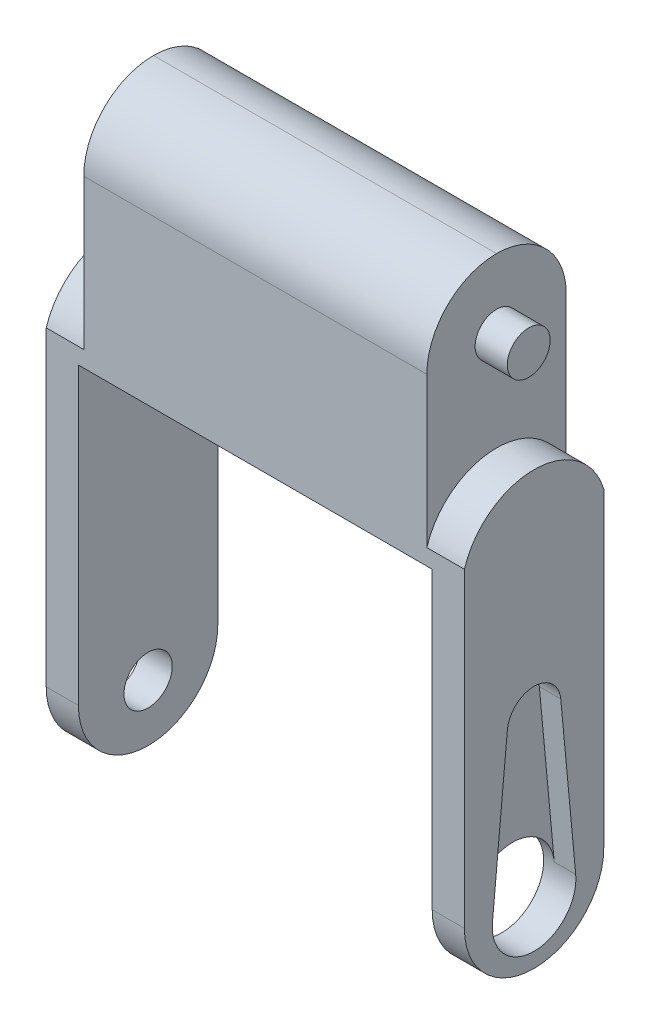
from build123d import *

# Parameters (mm, degrees)
BOSS_EXTRUDE1_DEPTH = 13
SKETCH2_R           = 2.25
CUT_EXTRUDE1_DEPTH  = 3
SKETCH3_R           = 2
BOSS_EXTRUDE2_DEPTH = 3
BOSS_EXTRUDE3_START = 3
SKETCH4_R           = 2
BOSS_EXTRUDE3_DEPTH = 3
CUT_EXTRUDE2_DEPTH  = 3.5
CUT_EXTRUDE3_START  = -3.5
CUT_EXTRUDE3_DEPTH  = 3.5
FILLET1_R           = 6.5
FILLET2_R           = 6.5
SKETCH7_R           = 3.9
CUT_EXTRUDE4_DEPTH  = 68.830671528
CUT_EXTRUDE5_START  = -2
CUT_EXTRUDE5_DEPTH  = 2


with BuildPart() as part:
    # Sketch1 → Boss-Extrude1 (new body)
    with BuildSketch(Plane.XY):
        Polygon((3, 0), (3, 34), (36, 34), (36, 0), (39, 0), (39, 42), (35.5, 42), (35.5, 56), (3.5, 56), (3.5, 42), (0, 42), (0, 0), align=None)
    extrude(amount=BOSS_EXTRUDE1_DEPTH)

    # Sketch2 → Cut-Extrude1 (cut)
    with BuildSketch(Plane.ZY):
        with Locations((6.5, 5.293988539)):
            Circle(SKETCH2_R)
    extrude(amount=-CUT_EXTRUDE1_DEPTH, mode=Mode.SUBTRACT)

    # Sketch3 → Boss-Extrude2 (add)
    with BuildSketch(Plane.ZY.offset(-3.5)):
        with Locations(Location((6.5, 49.5, 0), (0, 0, 180))):
            Circle(SKETCH3_R)
    extrude(amount=BOSS_EXTRUDE2_DEPTH)

    # Sketch4 → Boss-Extrude3 (add)
    with BuildSketch(Plane(origin=(35.5, 0, 0), x_dir=(0, 0, -1), z_dir=(1, 0, 0)).offset(BOSS_EXTRUDE3_START)):
        with Locations((-6.5, 49.5)):
            Circle(SKETCH4_R)
    extrude(amount=-BOSS_EXTRUDE3_DEPTH)

    # Sketch5 → Cut-Extrude2 (cut)
    with BuildSketch(Plane(origin=(39, 0, 0), x_dir=(0, 0, -1), z_dir=(1, 0, 0))):
        with BuildLine():
            Line((0, 35.5), (0, 45))
            Line((0, 45), (-13, 45))
            Line((-13, 45), (-13, 35.5))
            ThreePointArc((-13, 35.5), (-6.5, 40.300735254), (0, 35.5))
        make_face()
    extrude(amount=-CUT_EXTRUDE2_DEPTH, mode=Mode.SUBTRACT)

    # Sketch6 → Cut-Extrude3 (cut)
    with BuildSketch(Plane.ZY.offset(CUT_EXTRUDE3_START)):
        with BuildLine():
            Line((13, 35.5), (13, 45))
            Line((13, 45), (0, 45))
            Line((0, 45), (0, 35.5))
            ThreePointArc((0, 35.5), (6.5, 40.300735254), (13, 35.5))
        make_face()
    extrude(amount=CUT_EXTRUDE3_DEPTH, mode=Mode.SUBTRACT)

    # Fillet1
    fillet1_edges = [part.edges().sort_by_distance(p)[0] for p in [
        (19.5, 56, 13),
        (19.5, 56, 0),
    ]]
    fillet(fillet1_edges, radius=FILLET1_R - 0.0001)  # a hair under: the kernel refuses the full size

    # Fillet2
    fillet2_edges = [part.edges().sort_by_distance(p)[0] for p in [
        (37.5, 0, 13),
        (37.5, 0, 0),
        (1.5, 0, 13),
        (1.5, 0, 0),
    ]]
    fillet(fillet2_edges, radius=FILLET2_R - 0.0001)  # a hair under: the kernel refuses the full size

    # Sketch7 → Cut-Extrude4 (cut, through all)
    with BuildSketch(Plane.ZY.offset(-36)):
        with Locations((6.5, 5.293988539)):
            Circle(SKETCH7_R)
    extrude(amount=-CUT_EXTRUDE4_DEPTH, mode=Mode.SUBTRACT)

    # Sketch8 → Cut-Extrude5 (cut)
    with BuildSketch(Plane(origin=(39, 0, 0), x_dir=(0, 0, -1), z_dir=(1, 0, 0)).offset(CUT_EXTRUDE5_START)):
        with BuildLine():
            Line((-8.989087294, 20.527321872), (-10.382976178, 5.657988539))
            ThreePointArc((-10.382976178, 5.657988539), (-6.5, 1.393988539), (-2.617023822, 5.657988539))
            Line((-2.617023822, 5.657988539), (-4.010912706, 20.527321872))
            ThreePointArc((-4.010912706, 20.527321872), (-6.5, 22.793988539), (-8.989087294, 20.527321872))
        make_face()
    extrude(amount=CUT_EXTRUDE5_DEPTH, mode=Mode.SUBTRACT)


solid = part.part
